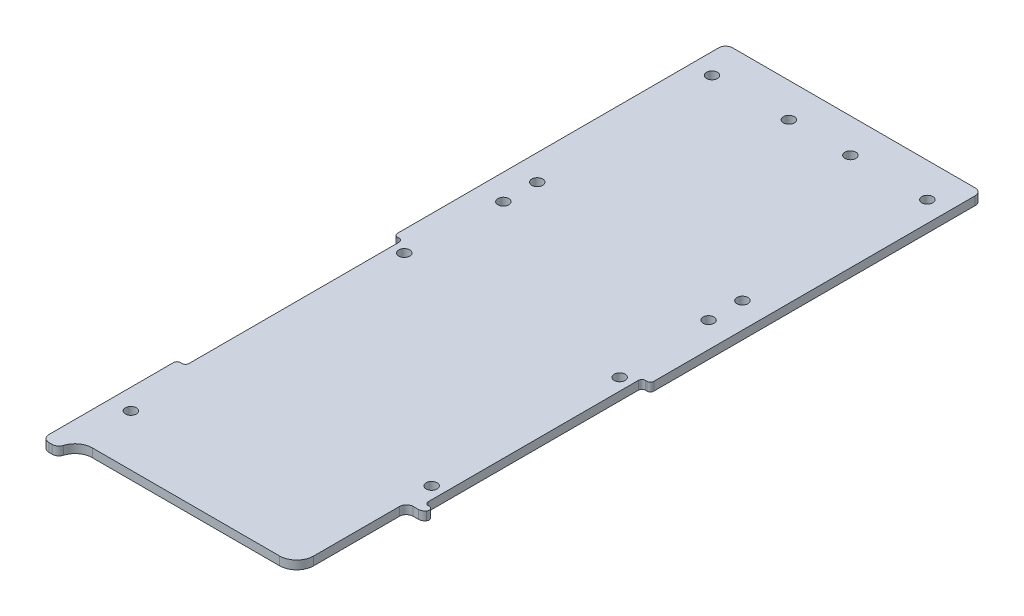
from build123d import *

# Parameters (mm, degrees)
SKETCH1_R               = 2.032
BOSS_EXTRUDE1_DEPTH     = 3.175
FILLET1_R               = 2.54
FILLET2_R               = 2.54
FILLET3_R               = 6.35
CUT_EXTRUDE1_DEPTH      = 136.673215063
FILLET4_R               = 6.35
FILLET5_R               = 2.54
SKETCH3_R               = 2.032
CUT_EXTRUDE2_DEPTH      = 136.673215063
CUT_EXTRUDE3_DEPTH      = 136.673215063
CUT_EXTRUDE3_DEPTH_BACK = 136.673215063
SKETCH4_W               = 3.175
SKETCH4_H               = 80.645
FILLET6_R               = 1.27


with BuildPart() as part:
    # Sketch1 → Boss-Extrude1 (new body)
    with BuildSketch(Plane(origin=(0, 0, 0), x_dir=(1, 0, 0), z_dir=(0, 1, 0))):
        Polygon((47.625, 127), (-47.625, 127), (-47.625, -127), (-41.275, -127), (-41.275, -120.65), (41.275, -120.65), (41.275, -127), (47.625, -127), align=None)
        with Locations((-39.999684148, -101.6)):
            Circle(SKETCH1_R, mode=Mode.SUBTRACT)
        with Locations((39.999684148, -69.85)):
            Circle(SKETCH1_R, mode=Mode.SUBTRACT)
        with Locations((-39.999684148, 0)):
            Circle(SKETCH1_R, mode=Mode.SUBTRACT)
        with Locations((-39.999684148, 114.3)):
            Circle(SKETCH1_R, mode=Mode.SUBTRACT)
        with Locations((-11.424684148, 114.3)):
            Circle(SKETCH1_R, mode=Mode.SUBTRACT)
        with Locations((39.999684148, 0)):
            Circle(SKETCH1_R, mode=Mode.SUBTRACT)
        with Locations((11.424684148, 114.3)):
            Circle(SKETCH1_R, mode=Mode.SUBTRACT)
        with Locations((39.999684148, 114.3)):
            Circle(SKETCH1_R, mode=Mode.SUBTRACT)
    extrude(amount=BOSS_EXTRUDE1_DEPTH)

    # Fillet1
    fillet1_edges = [part.edges().sort_by_distance(p)[0] for p in [
        (-47.625, 1.5875, -127),
        (47.625, 1.5875, -127),
        (47.625, 1.5875, 127),
        (-47.625, 1.5875, 127),
    ]]
    fillet(fillet1_edges, radius=FILLET1_R)

    # Fillet2
    fillet2_edges = [part.edges().sort_by_distance(p)[0] for p in [
        (41.275, 1.5875, 127),
        (-41.275, 1.5875, 127),
    ]]
    fillet(fillet2_edges, radius=FILLET2_R)

    # Fillet3
    fillet3_edges = [part.edges().sort_by_distance(p)[0] for p in [
        (41.275, 1.5875, 120.65),
        (-41.275, 1.5875, 120.65),
    ]]
    fillet(fillet3_edges, radius=FILLET3_R)

    # Sketch2 → Cut-Extrude1 (cut, through all)
    with BuildSketch(Plane.XZ):
        with BuildLine():
            Line((40.64508, 123.578690235), (40.64508, 79.88808))
            Line((40.64508, 79.88808), (47.625, 79.88808))
            Line((47.625, 79.88808), (47.625, 124.46))
            ThreePointArc((47.625, 124.46), (46.881051224, 126.256051224), (45.085, 127))
            Line((45.085, 127), (43.815, 127))
            ThreePointArc((43.815, 127), (42.297059666, 126.496530663), (41.380880287, 125.185714286))
            ThreePointArc((41.380880287, 125.185714286), (41.069166069, 124.356476684), (40.64508, 123.578690235))
        make_face()
    extrude(amount=-CUT_EXTRUDE1_DEPTH, mode=Mode.SUBTRACT)

    # Fillet4
    fillet4_edges = [part.edges().sort_by_distance(p)[0] for p in [
        (40.64508, 1.5875, 123.578690235),
    ]]
    fillet(fillet4_edges, radius=FILLET4_R)

    # Fillet5
    fillet5_edges = [part.edges().sort_by_distance(p)[0] for p in [
        (47.625, 1.5875, 79.88808),
        (40.64508, 1.5875, 79.88808),
    ]]
    fillet(fillet5_edges, radius=FILLET5_R)

    # Sketch3 → Cut-Extrude2 (cut, through all)
    with BuildSketch(Plane.XZ):
        with Locations((-38.109526801, -34.913768806)):
            Circle(SKETCH3_R)
        with Locations((-38.109526801, -47.490173279)):
            Circle(SKETCH3_R)
        with Locations((38.109526801, -47.490173279)):
            Circle(SKETCH3_R)
        with Locations((38.109526801, -34.913768806)):
            Circle(SKETCH3_R)
    extrude(amount=-CUT_EXTRUDE2_DEPTH, mode=Mode.SUBTRACT)

    # Sketch4 → Cut-Extrude3 (cut, two sides: drawn at the far end of the back side and taken through both)
    with BuildSketch(Plane(origin=(0, 3.175, 0), x_dir=(1, 0, 0), z_dir=(0, 1, 0)).offset(-CUT_EXTRUDE3_DEPTH_BACK)):
        with Locations((-46.0375, -36.5125)):
            Rectangle(SKETCH4_W, SKETCH4_H)
        with Locations((46.0375, -36.5125)):
            Rectangle(SKETCH4_W, SKETCH4_H)
    extrude(amount=CUT_EXTRUDE3_DEPTH + CUT_EXTRUDE3_DEPTH_BACK, mode=Mode.SUBTRACT)

    # Fillet6
    fillet6_edges = [part.edges().sort_by_distance(p)[0] for p in [
        (-44.45, 1.5875, -3.81),
        (-47.625, 1.5875, -3.81),
        (-47.625, 1.5875, 76.835),
        (-44.45, 1.5875, 76.835),
        (44.45, 1.5875, 76.835),
        (47.625, 1.5875, 76.835),
        (44.45, 1.5875, -3.81),
        (47.625, 1.5875, -3.81),
    ]]
    fillet(fillet6_edges, radius=FILLET6_R)


solid = part.part
